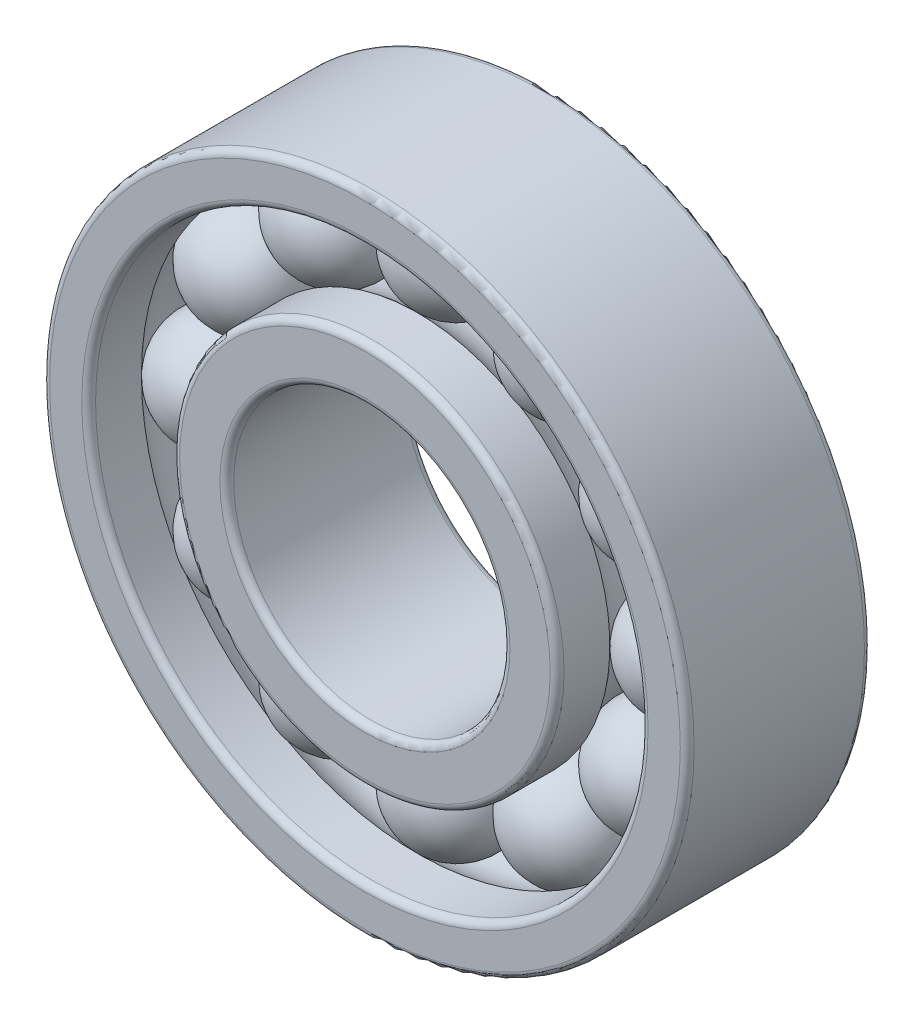
from build123d import *

# Parameters (mm, degrees)
SKETCH1_R             = 14
SKETCH1_R_2           = 12
BOSS_EXTRUDE1_DEPTH   = 8
SKETCH1_R_3           = 8.35
SKETCH1_R_4           = 6
BOSS_EXTRUDE1_2_DEPTH = 8
SKETCH4_R             = 2.5
CIRPATTERN1_COUNT     = 12
FILLET1_R             = 0.3
FILLET2_R             = 0.3


with BuildPart() as part:
    # Sketch1 → Boss-Extrude1 (new body)
    with BuildSketch(Plane.XY):
        Circle(SKETCH1_R)
        Circle(SKETCH1_R_2, mode=Mode.SUBTRACT)
    extrude(amount=BOSS_EXTRUDE1_DEPTH)


with BuildPart() as body_2:
    # Sketch1 → Boss-Extrude1 2 (new body)
    with BuildSketch(Plane.XY):
        Circle(SKETCH1_R_3)
        Circle(SKETCH1_R_4, mode=Mode.SUBTRACT)
    extrude(amount=BOSS_EXTRUDE1_2_DEPTH)


with BuildPart() as cut_sweep1_tool:
    # Cut-Sweep1: sweep along a path in Sketch2
    with BuildLine(Plane.XY.offset(4)) as cut_sweep1_path:
        CenterArc((0, 0), 10.175, 0, 360)
    # Sketch4 → Cut-Sweep1 (sweep)
    with BuildSketch(Plane(origin=(0, 0, 0), x_dir=(1, 0, 0), z_dir=(0, 1, 0))):
        with Locations((-10.175, -4)):
            Circle(SKETCH4_R)
    sweep(path=cut_sweep1_path.line)


with BuildPart() as part_1:
    add(part.part)

    # Cut-Sweep1: cut by cut_sweep1_tool
    add(cut_sweep1_tool.part, mode=Mode.SUBTRACT)

    # Fillet1
    fillet1_edges = [part_1.edges().sort_by_distance(p)[0] for p in [
        (-12, 0, 0),
        (-14, 0, 0),
        (-12, 0, 8),
        (-14, 0, 8),
    ]]
    fillet(fillet1_edges, radius=FILLET1_R)


with BuildPart() as body_2_1:
    add(body_2.part)

    # Cut-Sweep1: cut by cut_sweep1_tool
    add(cut_sweep1_tool.part, mode=Mode.SUBTRACT)

    # Fillet2
    fillet2_edges = [body_2_1.edges().sort_by_distance(p)[0] for p in [
        (-6, 0, 8),
        (-8.35, 0, 8),
        (-6, 0, 0),
        (-8.35, 0, 0),
    ]]
    fillet(fillet2_edges, radius=FILLET2_R)


with BuildPart() as body_3:
    # Sketch5 → Revolve1 (revolve)
    with BuildSketch(Plane(origin=(0, 0, 0), x_dir=(1, 0, 0), z_dir=(0, 1, 0))):
        with BuildLine():
            Line((-10.175, -1.5), (-10.175, -6.5))
            ThreePointArc((-10.175, -6.5), (-12.675, -4), (-10.175, -1.5))
        make_face()
    revolve(axis=Axis((-10.175, 0, 1.5), (0, 0, 1)))


with BuildPart() as cirpattern1_1:
    # CirPattern1: pattern copy
    add(body_3.part.rotate(Axis((0, 0, 8), (0, 0, -1)), 1 * 360 / CIRPATTERN1_COUNT))


with BuildPart() as cirpattern1_2:
    # CirPattern1: pattern copy
    add(body_3.part.rotate(Axis((0, 0, 8), (0, 0, -1)), 2 * 360 / CIRPATTERN1_COUNT))


with BuildPart() as cirpattern1_3:
    # CirPattern1: pattern copy
    add(body_3.part.rotate(Axis((0, 0, 8), (0, 0, -1)), 3 * 360 / CIRPATTERN1_COUNT))


with BuildPart() as cirpattern1_4:
    # CirPattern1: pattern copy
    add(body_3.part.rotate(Axis((0, 0, 8), (0, 0, -1)), 4 * 360 / CIRPATTERN1_COUNT))


with BuildPart() as cirpattern1_5:
    # CirPattern1: pattern copy
    add(body_3.part.rotate(Axis((0, 0, 8), (0, 0, -1)), 5 * 360 / CIRPATTERN1_COUNT))


with BuildPart() as cirpattern1_6:
    # CirPattern1: pattern copy
    add(body_3.part.rotate(Axis((0, 0, 8), (0, 0, -1)), 6 * 360 / CIRPATTERN1_COUNT))


with BuildPart() as cirpattern1_7:
    # CirPattern1: pattern copy
    add(body_3.part.rotate(Axis((0, 0, 8), (0, 0, -1)), 7 * 360 / CIRPATTERN1_COUNT))


with BuildPart() as cirpattern1_8:
    # CirPattern1: pattern copy
    add(body_3.part.rotate(Axis((0, 0, 8), (0, 0, -1)), 8 * 360 / CIRPATTERN1_COUNT))


with BuildPart() as cirpattern1_9:
    # CirPattern1: pattern copy
    add(body_3.part.rotate(Axis((0, 0, 8), (0, 0, -1)), 9 * 360 / CIRPATTERN1_COUNT))


with BuildPart() as cirpattern1_10:
    # CirPattern1: pattern copy
    add(body_3.part.rotate(Axis((0, 0, 8), (0, 0, -1)), 10 * 360 / CIRPATTERN1_COUNT))


with BuildPart() as cirpattern1_11:
    # CirPattern1: pattern copy
    add(body_3.part.rotate(Axis((0, 0, 8), (0, 0, -1)), 11 * 360 / CIRPATTERN1_COUNT))


solid = Compound([part_1.part, body_2_1.part, body_3.part, cirpattern1_1.part, cirpattern1_2.part, cirpattern1_3.part, cirpattern1_4.part, cirpattern1_5.part, cirpattern1_6.part, cirpattern1_7.part, cirpattern1_8.part, cirpattern1_9.part, cirpattern1_10.part, cirpattern1_11.part])
